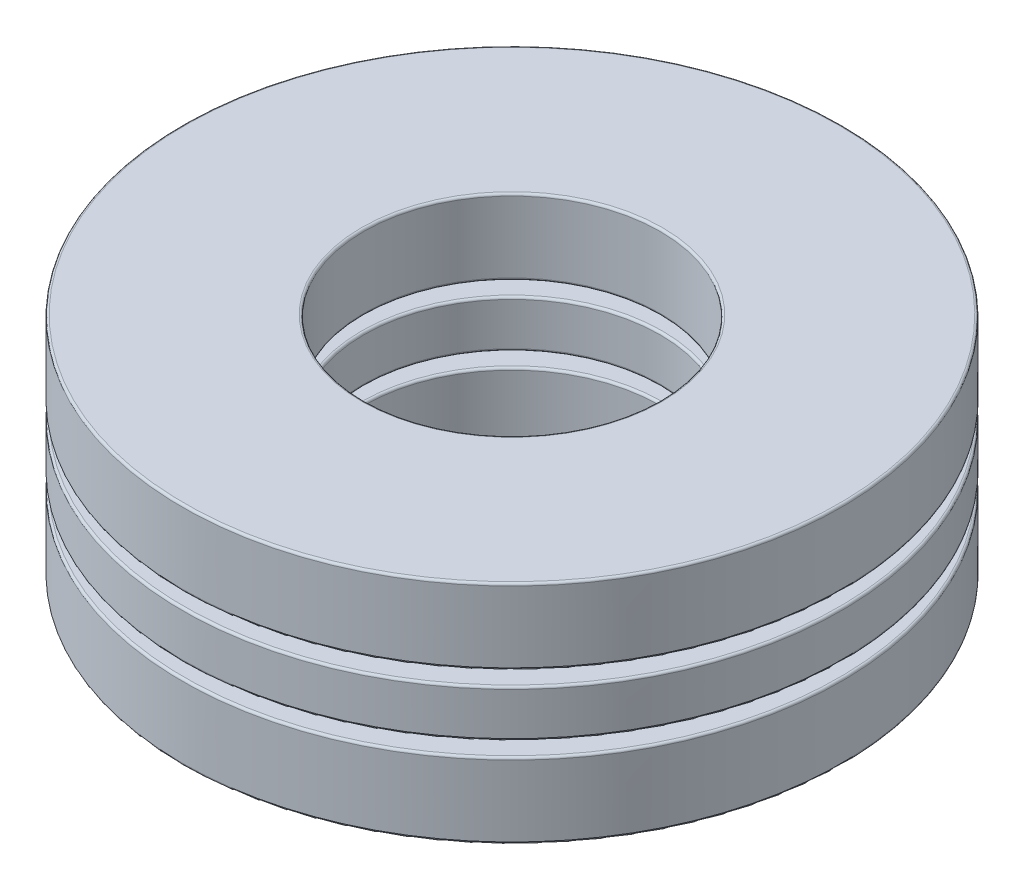
from build123d import *

# Parameters (mm, degrees)
SKETCH1_W         = 3.93065
SKETCH1_H         = 1.021291666
CIRPATTERN1_COUNT = 3
CIRPATTERN1_ANGLE = 240
CIRPATTERN2_COUNT = 3
SKETCH4_W         = 3.93065
SKETCH4_H         = 1.634066667
FILLET1_R         = 0.049022
FILLET2_R         = 0.049022
FILLET3_R         = 0.049022


with BuildPart() as part:
    # Sketch1 → Revolve1 (revolve)
    with BuildSketch(Plane(origin=(0, 0, 0), x_dir=(0, 0, -1), z_dir=(1, 0, 0))):
        with Locations((-5.178425, 0)):
            Rectangle(SKETCH1_W, SKETCH1_H)
    revolve(axis=Axis((0, -2.4511, 0), (0, 1, 0)))

    # Sketch3 → Cut-Revolve1 (revolve, cut)
    with BuildSketch(Plane(origin=(0, 0, 0), x_dir=(0, 0, -1), z_dir=(1, 0, 0))):
        with BuildLine():
            Line((-5.178425, 0.817033333), (-5.178425, -0.817033333))
            ThreePointArc((-5.178425, -0.817033333), (-5.995458333, 0), (-5.178425, 0.817033333))
        make_face()
    cut_revolve1 = revolve(axis=Axis((0, 0.817033333, 5.178425), (0, -1, 0)), mode=Mode.SUBTRACT)

    # CirPattern2: Cut-Revolve1 ×3 about axis
    cirpattern2_axis = Axis((0, 2.4511, 0), (0, -1, 0))
    for i in range(1, CIRPATTERN2_COUNT):
        add(cut_revolve1.rotate(cirpattern2_axis, i * 360 / CIRPATTERN2_COUNT), mode=Mode.SUBTRACT)

    # Fillet2
    fillet2_edges = [part.edges().sort_by_distance(p)[0] for p in [
        (0, -0.510645833, -3.2131),
        (0, 0.510645833, -3.2131),
        (0, -0.510645833, -7.14375),
        (0, 0.510645833, -7.14375),
    ]]
    fillet(fillet2_edges, radius=FILLET2_R)


with BuildPart() as body_2:
    # Sketch2 → Revolve2 (revolve)
    with BuildSketch(Plane(origin=(0, 0, 0), x_dir=(0, 0, -1), z_dir=(1, 0, 0))):
        with BuildLine():
            Line((-5.178425, 0.817033333), (-5.178425, -0.817033333))
            ThreePointArc((-5.178425, -0.817033333), (-5.995458333, 0), (-5.178425, 0.817033333))
        make_face()
    revolve(axis=Axis((0, 0.817033333, 5.178425), (0, -1, 0)))


with BuildPart() as cirpattern1_1:
    # CirPattern1: pattern copy
    add(body_2.part.rotate(Axis((0, 2.4511, 0), (0, -1, 0)), 1 * CIRPATTERN1_ANGLE / (CIRPATTERN1_COUNT - 1)))


with BuildPart() as cirpattern1_2:
    # CirPattern1: pattern copy
    add(body_2.part.rotate(Axis((0, 2.4511, 0), (0, -1, 0)), 2 * CIRPATTERN1_ANGLE / (CIRPATTERN1_COUNT - 1)))


with BuildPart() as body_5:
    # Sketch4 → Revolve3 (revolve)
    with BuildSketch(Plane(origin=(0, 0, 0), x_dir=(0, 0, -1), z_dir=(1, 0, 0))):
        with Locations((-5.178425, 1.634066667)):
            Rectangle(SKETCH4_W, SKETCH4_H)
        with Locations((-5.178425, -1.634066667)):
            Rectangle(SKETCH4_W, SKETCH4_H)
    revolve(axis=Axis((0, -2.4511, 0), (0, 1, 0)))

    # Fillet1
    fillet1_edges = [body_5.edges().sort_by_distance(p)[0] for p in [
        (0, 0.817033333, -3.2131),
        (0, 2.4511, -3.2131),
        (0, 0.817033333, -7.14375),
        (0, 2.4511, -7.14375),
    ]]
    fillet(fillet1_edges, radius=FILLET1_R)

    # Fillet3
    fillet3_edges = [body_5.edges().sort_by_distance(p)[0] for p in [
        (0, -2.4511, -3.2131),
        (0, -0.817033333, -3.2131),
        (0, -2.4511, -7.14375),
        (0, -0.817033333, -7.14375),
    ]]
    fillet(fillet3_edges, radius=FILLET3_R)


solid = Compound([part.part, body_2.part, cirpattern1_1.part, cirpattern1_2.part, body_5.part])
